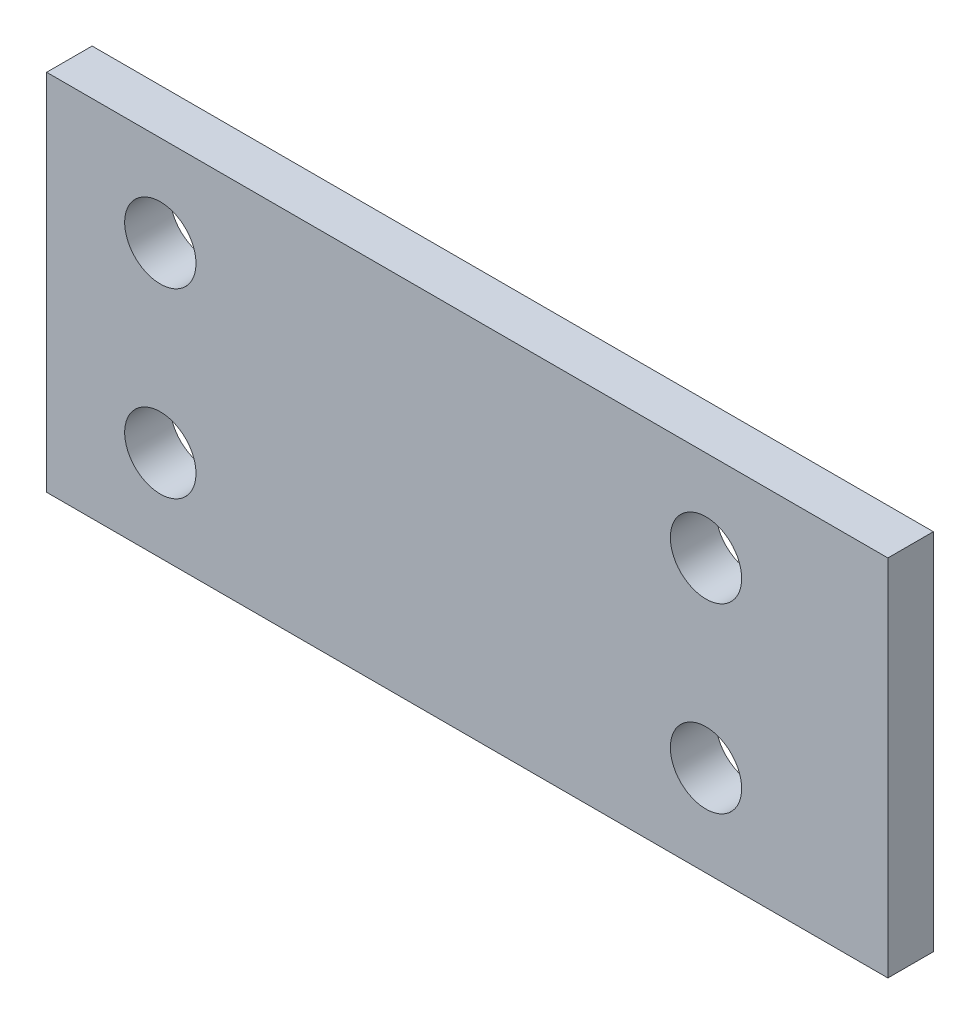
from build123d import *

# Parameters (mm, degrees)
SKETCH1_W           = 58.7375
SKETCH1_H           = 25.4
SKETCH1_R           = 2.4892
BOSS_EXTRUDE1_DEPTH = 1.5875


with BuildPart() as part:
    # Sketch1 → Boss-Extrude1 (new, symmetric)
    with BuildSketch(Plane.XY):
        Rectangle(SKETCH1_W, SKETCH1_H)
        with Locations((-21.43125, -6.35)):
            Circle(SKETCH1_R, mode=Mode.SUBTRACT)
        with Locations((16.66875, -6.35)):
            Circle(SKETCH1_R, mode=Mode.SUBTRACT)
        with Locations((-21.43125, 6.35)):
            Circle(SKETCH1_R, mode=Mode.SUBTRACT)
        with Locations((16.66875, 6.35)):
            Circle(SKETCH1_R, mode=Mode.SUBTRACT)
    extrude(amount=BOSS_EXTRUDE1_DEPTH, both=True)


solid = part.part
